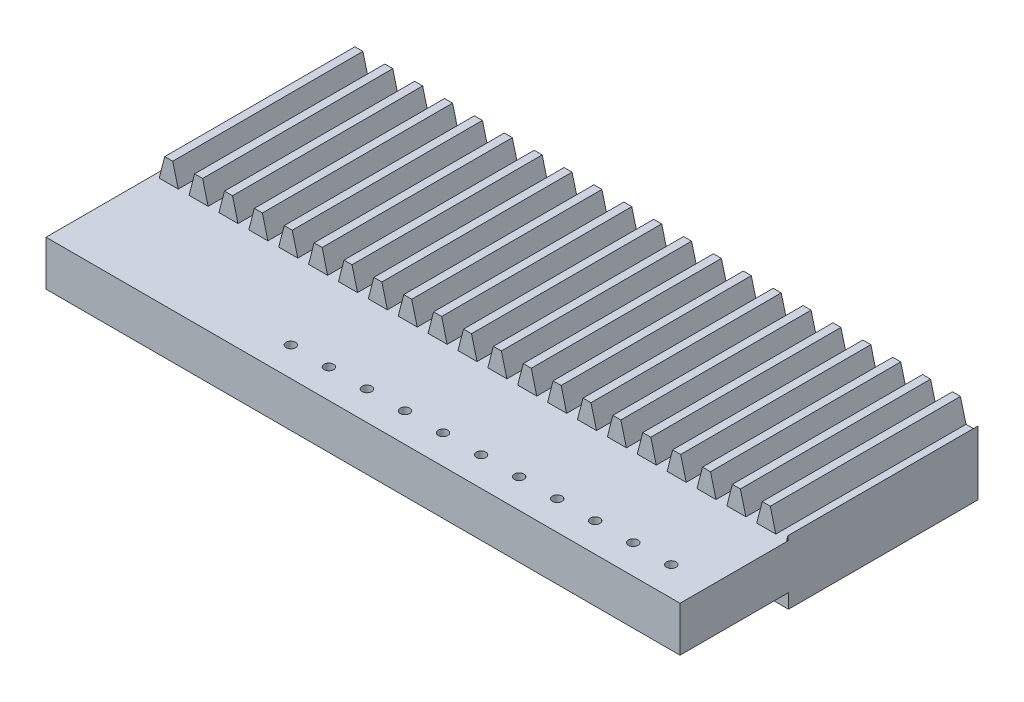
from build123d import *

# Parameters (mm, degrees)
BLANKSKE_W              = 100
BLANKSKE_H              = 12.75
BLANK_DEPTH             = 20
TOOTHCUTSIM_DEPTH       = 103.77432802
TEETHCUTS_COUNT         = 23
TEETHCUTS_PITCH         = 4.712388975
SALIENTE_EXTRUIR1_DEPTH = 10
CROQUIS3_W              = 100
CROQUIS3_H              = 9.375
SALIENTE_EXTRUIR3_DEPTH = 17
CROQUIS4_W              = 17.104560842
CROQUIS4_H              = 2.275
CORTAR_EXTRUIR1_DEPTH   = 105.36264897
CROQUIS8_R              = 0.75
CORTAR_EXTRUIR3_DEPTH   = 6


with BuildPart() as part:
    # BlankSke → Blank (new body)
    with BuildSketch(Plane.XY):
        with Locations((50, 6.375)):
            Rectangle(BLANKSKE_W, BLANKSKE_H)
    extrude(amount=-BLANK_DEPTH)

    # TooCutSkeSim → ToothCutSim (cut, through all)
    with BuildSketch(Plane.XY):
        Polygon((0.852189273, 9.375), (-0.852189273, 9.375), (-1.731592507, 12.7754), (1.731592507, 12.7754), align=None)
    toothcutsim = extrude(amount=-TOOTHCUTSIM_DEPTH, mode=Mode.SUBTRACT)

    # TeethCuts: ToothCutSim ×23
    with Locations(*[(i * TEETHCUTS_PITCH, 0, 0) for i in range(1, TEETHCUTS_COUNT)]):
        add(toothcutsim, mode=Mode.SUBTRACT)

    # Croquis1 → Saliente-Extruir1 (add)
    with BuildSketch(Plane.XY):
        Polygon((99.812357748, 9.375), (98.107979202, 9.375), (97.235144855, 12.75), (95.97280312, 12.75), (95.099968773, 9.375), (93.395590227, 9.375), (92.52275588, 12.75), (91.260414145, 12.75), (90.387579798, 9.375), (88.683201252, 9.375), (87.810366905, 12.75), (86.54802517, 12.75), (85.675190823, 9.375), (83.970812277, 9.375), (83.09797793, 12.75), (81.835636195, 12.75), (80.962801848, 9.375), (79.258423302, 9.375), (78.385588955, 12.75), (77.12324722, 12.75), (76.250412873, 9.375), (74.546034327, 9.375), (73.67319998, 12.75), (72.410858245, 12.75), (71.538023898, 9.375), (69.833645352, 9.375), (68.960811005, 12.75), (67.69846927, 12.75), (66.825634923, 9.375), (65.121256377, 9.375), (64.24842203, 12.75), (62.986080295, 12.75), (62.113245948, 9.375), (60.408867402, 9.375), (59.536033055, 12.75), (58.27369132, 12.75), (57.400856973, 9.375), (55.696478427, 9.375), (54.82364408, 12.75), (53.561302345, 12.75), (52.688467998, 9.375), (50.984089452, 9.375), (50.111255105, 12.75), (48.84891337, 12.75), (47.976079023, 9.375), (46.271700477, 9.375), (45.39886613, 12.75), (44.136524395, 12.75), (43.263690048, 9.375), (41.559311502, 9.375), (40.686477155, 12.75), (39.42413542, 12.75), (38.551301073, 9.375), (36.846922527, 9.375), (35.97408818, 12.75), (34.711746445, 12.75), (33.838912098, 9.375), (32.134533552, 9.375), (31.261699205, 12.75), (29.99935747, 12.75), (29.126523123, 9.375), (27.422144577, 9.375), (26.54931023, 12.75), (25.286968495, 12.75), (24.414134148, 9.375), (22.709755602, 9.375), (21.836921255, 12.75), (20.57457952, 12.75), (19.701745173, 9.375), (17.997366627, 9.375), (17.12453228, 12.75), (15.862190545, 12.75), (14.989356198, 9.375), (13.284977652, 9.375), (12.412143305, 12.75), (11.14980157, 12.75), (10.276967223, 9.375), (8.572588677, 9.375), (7.69975433, 12.75), (6.437412595, 12.75), (5.564578248, 9.375), (3.860199702, 9.375), (2.987365355, 12.75), (1.72502362, 12.75), (0.852189273, 9.375), (0, 9.375), (0, 0), (100, 0), (100, 10.100558753), align=None)
    extrude(amount=SALIENTE_EXTRUIR1_DEPTH)

    # Croquis3 → Saliente-Extruir3 (add)
    with BuildSketch(Plane.XY.offset(10)):
        with Locations((50, 4.6875)):
            Rectangle(CROQUIS3_W, CROQUIS3_H)
    extrude(amount=SALIENTE_EXTRUIR3_DEPTH)

    # Croquis4 → Cortar-Extruir1 (cut, through all)
    with BuildSketch(Plane(origin=(100, 0, 0), x_dir=(0, 0, -1), z_dir=(1, 0, 0))):
        with Locations((-18.447719579, 1.1375)):
            Rectangle(CROQUIS4_W, CROQUIS4_H)
    extrude(amount=-CORTAR_EXTRUIR1_DEPTH, mode=Mode.SUBTRACT)

    # Croquis8 → Cortar-Extruir3 (cut)
    with BuildSketch(Plane(origin=(0, 9.375, 0), x_dir=(1, 0, 0), z_dir=(0, 1, 0))):
        with Locations((64.029982965, -22.41075444)):
            Circle(CROQUIS8_R)
        with Locations((70.029982965, -22.41075444)):
            Circle(CROQUIS8_R)
        with Locations((76.029982965, -22.41075444)):
            Circle(CROQUIS8_R)
        with Locations((82.029982965, -22.41075444)):
            Circle(CROQUIS8_R)
        with Locations((88.029982965, -22.41075444)):
            Circle(CROQUIS8_R)
        with Locations((94.029982965, -22.41075444)):
            Circle(CROQUIS8_R)
        with Locations((58.029982965, -22.41075444)):
            Circle(CROQUIS8_R)
        with Locations((52.029982965, -22.41075444)):
            Circle(CROQUIS8_R)
        with Locations((46.029982965, -22.41075444)):
            Circle(CROQUIS8_R)
        with Locations((40.029982965, -22.41075444)):
            Circle(CROQUIS8_R)
        with Locations((34.029982965, -22.41075444)):
            Circle(CROQUIS8_R)
    extrude(amount=-CORTAR_EXTRUIR3_DEPTH, mode=Mode.SUBTRACT)


solid = part.part
